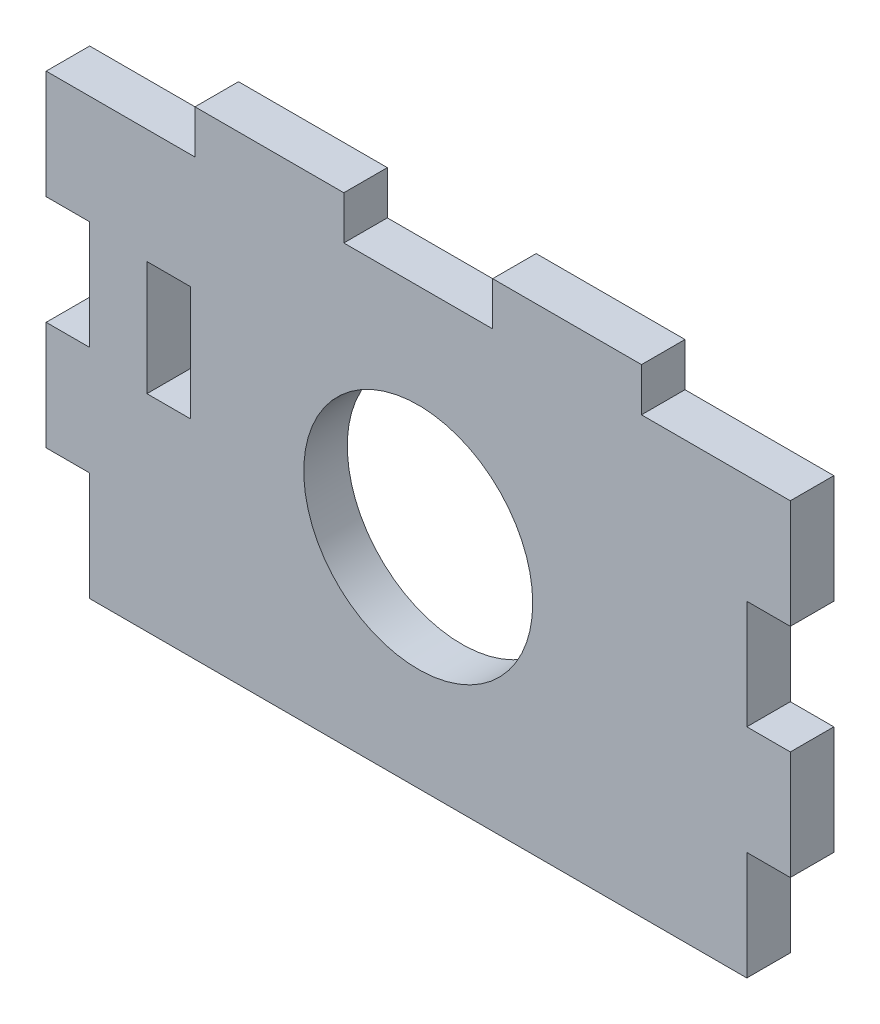
from build123d import *

# Parameters (mm, degrees)
SKETCH1_W                = 82.55
SKETCH1_H                = 53.086
BOSS_EXTRUDE1_DEPTH      = 4.826
CUT_EXTRUDE1_START       = -88.085249325
CUT_EXTRUDE1_OUTLINE_W   = 4.826
CUT_EXTRUDE1_OUTLINE_H   = 4.826
CUT_EXTRUDE1_DEPTH       = 16.51
CUT_EXTRUDE1_START_2     = -55.065249325
CUT_EXTRUDE1_2_OUTLINE_W = 4.826
CUT_EXTRUDE1_2_OUTLINE_H = 4.826
CUT_EXTRUDE1_2_DEPTH     = 16.51
CUT_EXTRUDE1_START_3     = -22.045249325
CUT_EXTRUDE1_3_OUTLINE_W = 4.826
CUT_EXTRUDE1_3_OUTLINE_H = 4.826
CUT_EXTRUDE1_3_DEPTH     = 16.51
SKETCH3_W                = 4.826
SKETCH3_H                = 12.065
CUT_EXTRUDE2_DEPTH       = 97.443575108
SKETCH4_R                = 12.7
CUT_EXTRUDE3_DEPTH       = 97.443575108
SKETCH5_W                = 4.826
SKETCH5_H                = 12.7
CUT_EXTRUDE4_DEPTH       = 97.443575108


# Read off the part's stored shape, not the designer's step: Cut-Extrude1
with BuildPart() as part:
    # Sketch1 → Boss-Extrude1 (new body)
    with BuildSketch(Plane.XY):
        with Locations((-46.810249325, -12.432142782)):
            Rectangle(SKETCH1_W, SKETCH1_H)
    extrude(amount=BOSS_EXTRUDE1_DEPTH)

    # Cut-Extrude1 outline → Cut-Extrude1 (cut)
    with BuildSketch(Plane.YZ.offset(CUT_EXTRUDE1_START)):
        with Locations((11.697857218, 2.413)):
            Rectangle(CUT_EXTRUDE1_OUTLINE_W, CUT_EXTRUDE1_OUTLINE_H)
    extrude(amount=CUT_EXTRUDE1_DEPTH, mode=Mode.SUBTRACT)

    # Cut-Extrude1 2 outline → Cut-Extrude1 2 (cut)
    with BuildSketch(Plane.YZ.offset(CUT_EXTRUDE1_START_2)):
        with Locations((11.697857218, 2.413)):
            Rectangle(CUT_EXTRUDE1_2_OUTLINE_W, CUT_EXTRUDE1_2_OUTLINE_H)
    extrude(amount=CUT_EXTRUDE1_2_DEPTH, mode=Mode.SUBTRACT)

    # Cut-Extrude1 3 outline → Cut-Extrude1 3 (cut)
    with BuildSketch(Plane.YZ.offset(CUT_EXTRUDE1_START_3)):
        with Locations((11.697857218, 2.413)):
            Rectangle(CUT_EXTRUDE1_3_OUTLINE_W, CUT_EXTRUDE1_3_OUTLINE_H)
    extrude(amount=CUT_EXTRUDE1_3_DEPTH, mode=Mode.SUBTRACT)

    # Sketch3 → Cut-Extrude2 (cut, through all)
    with BuildSketch(Plane.XY.offset(4.826)):
        with Locations((-85.672249325, -32.942642782)):
            Rectangle(SKETCH3_W, SKETCH3_H)
        with Locations((-85.672249325, -8.812642782)):
            Rectangle(SKETCH3_W, SKETCH3_H)
        with Locations((-7.948249325, -32.942642782)):
            Rectangle(SKETCH3_W, SKETCH3_H)
        with Locations((-7.948249325, -8.812642782)):
            Rectangle(SKETCH3_W, SKETCH3_H)
    extrude(amount=-CUT_EXTRUDE2_DEPTH, mode=Mode.SUBTRACT)

    # Sketch4 → Cut-Extrude3 (cut, through all)
    with BuildSketch(Plane.XY.offset(4.826)):
        with Locations((-46.810249325, -14.845142782)):
            Circle(SKETCH4_R)
    extrude(amount=-CUT_EXTRUDE3_DEPTH, mode=Mode.SUBTRACT)

    # Sketch5 → Cut-Extrude4 (cut, through all)
    with BuildSketch(Plane.XY.offset(4.826)):
        with Locations((-74.496249325, -9.765142782)):
            Rectangle(SKETCH5_W, SKETCH5_H)
    extrude(amount=-CUT_EXTRUDE4_DEPTH, mode=Mode.SUBTRACT)


solid = part.part
